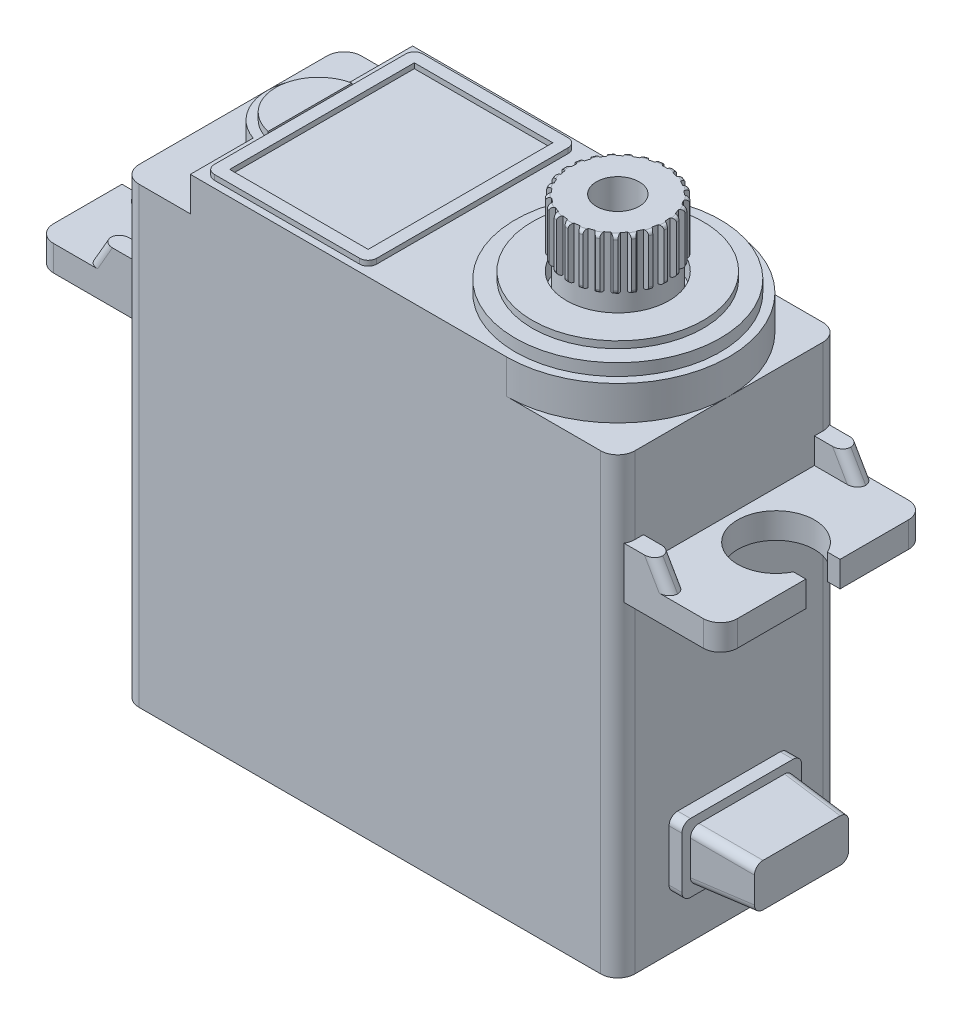
from build123d import *
from OCP.BRepFilletAPI import BRepFilletAPI_MakeChamfer

# Parameters (mm, degrees)
SKETCH1_W               = 29
SKETCH1_H               = 13.000000000000002
BOSS_EXTRUDE1_DEPTH     = 28.5
BOSS_EXTRUDE2_DEPTH     = 5.5
SKETCH4_W               = 1
SKETCH4_H               = 1.5000000000000036
BOSS_EXTRUDE3_DEPTH     = 2.5
CUT_EXTRUDE2_DEPTH      = 2
CUT_EXTRUDE1_DEPTH      = 2
SKETCH7_R               = 6
SKETCH7_R_2             = 2.999999999999999
BOSS_EXTRUDE4_DEPTH     = 0.7
SKETCH8_R               = 5.000000000000001
SKETCH8_R_2             = 2.999999999999999
BOSS_EXTRUDE5_DEPTH     = 0.4
BOSS_EXTRUDE6_DEPTH     = 0.3
BOSS_EXTRUDE7_DEPTH     = 0.4
SKETCH11_R              = 2.7499999999999982
SKETCH11_R_2            = 1.2499999999999991
BOSS_EXTRUDE8_DEPTH     = 5
BOSS_EXTRUDE9_START     = -3
BOSS_EXTRUDE9_DEPTH     = 3
CIRPATTERN1_COUNT       = 25
FILLET1_R               = 0.2
CUT_EXTRUDE3_DEPTH      = 10
SKETCH15_W              = 0.5000000000000009
SKETCH15_H              = 3
CUT_EXTRUDE4_DEPTH      = 5.5
SKETCH16_W              = 0.5
SKETCH16_H              = 1.5000000000000036
BOSS_EXTRUDE10_DEPTH    = 2.5
MIRROR4_COPY_1_SKETCH_W = 0.5000000000000009
MIRROR4_COPY_1_SKETCH_H = 3
MIRROR4_COPY_1_DEPTH    = 5.5
MIRROR4_COPY_2_SKETCH_W = 0.5
MIRROR4_COPY_2_SKETCH_H = 1.5000000000000036
MIRROR4_COPY_2_DEPTH    = 2.5
FILLET2_R               = 1
CHAMFER1_SIZE           = 0.866025404
CHAMFER1_SIZE_2         = 1.5
FILLET3_R               = 0.5
BOSS_EXTRUDE11_DEPTH    = 0.75
BOSS_EXTRUDE12_DEPTH    = 3.5
CHAMFER2_SIZE           = 3.5
CHAMFER2_SIZE_2         = 0.244743842
FILLET4_R               = 0.5


# Some blends are built 0.0001 mm under size
with BuildPart() as part:
    # Sketch1 → Boss-Extrude1 (new body)
    with BuildSketch(Plane(origin=(0, 0, 0), x_dir=(1, 0, 0), z_dir=(0, 1, 0))):
        Rectangle(SKETCH1_W, SKETCH1_H)
    extrude(amount=BOSS_EXTRUDE1_DEPTH)

    # Sketch3 → Boss-Extrude2 (add)
    with BuildSketch(Plane.ZY.offset(14.500000000000002)):
        Polygon((6.500000000000001, 20.5), (-6.499999999999999, 20.5), (-6.5, 18.999999999999996), (6.500000000000001, 19), align=None)
    boss_extrude2 = extrude(amount=BOSS_EXTRUDE2_DEPTH)

    # Sketch4 → Boss-Extrude3 (add)
    with BuildSketch(Plane.ZY.offset(14.500000000000002)):
        with Locations((-5.999999999999999, 21.25)):
            Rectangle(SKETCH4_W, SKETCH4_H)
        with Locations((6.000000000000001, 21.25)):
            Rectangle(SKETCH4_W, SKETCH4_H)
    boss_extrude3 = extrude(amount=BOSS_EXTRUDE3_DEPTH)

    # Sketch6 → Cut-Extrude2 (cut)
    with BuildSketch(Plane(origin=(0, 28.5, 0), x_dir=(1, 0, 0), z_dir=(0, 1, 0))):
        with BuildLine():
            Line((-14.500000000000002, 6.5), (-14.500000000000002, -6.5))
            Line((-14.500000000000002, -6.5), (-10.500000000000002, -6.5))
            Line((-10.500000000000002, -6.5), (-10.500000000000002, -2.828427124746192))
            ThreePointArc((-10.499999999999996, -2.82842712474619), (-12.500000000000002, 2.1e-15), (-10.499999999999996, 2.8284271247461943))
            Line((-10.500000000000002, 2.828427124746197), (-10.500000000000002, 6.5))
            Line((-10.500000000000002, 6.5), (-14.500000000000002, 6.5))
        make_face()
    extrude(amount=-CUT_EXTRUDE2_DEPTH, mode=Mode.SUBTRACT)

    # Mirror1: Boss-Extrude2, Boss-Extrude3 across plane
    add(boss_extrude2.mirror(Plane(origin=(0, 0, 0), x_dir=(0, 0, 1), z_dir=(1, 0, 0))))
    add(boss_extrude3.mirror(Plane(origin=(0, 0, 0), x_dir=(0, 0, 1), z_dir=(1, 0, 0))))

    # Sketch5 → Cut-Extrude1 (cut)
    with BuildSketch(Plane(origin=(0, 28.5, 0), x_dir=(1, 0, 0), z_dir=(0, 1, 0))):
        with BuildLine():
            Line((14.499999999999998, 6.5), (8.000000000000668, 6.5))
            ThreePointArc((8.000000000000668, 6.499999999999999), (12.596194077712795, 4.5961940777123225), (14.5, 0))
            Line((14.499999999999998, 0), (14.499999999999998, 6.5))
        make_face()
        with BuildLine():
            Line((14.499999999999998, -6.5), (14.499999999999998, 0))
            ThreePointArc((14.5, -1.59e-15), (12.596194077712791, -4.596194077712326), (8.000000000000663, -6.499999999999999))
            Line((8.000000000000663, -6.5), (14.499999999999998, -6.5))
        make_face()
    extrude(amount=-CUT_EXTRUDE1_DEPTH, mode=Mode.SUBTRACT)

    # Sketch7 → Boss-Extrude4 (add)
    with BuildSketch(Plane(origin=(0, 28.5, 0), x_dir=(1, 0, 0), z_dir=(0, 1, 0))):
        with Locations(Location((8, 0, 0), (0, 0, 270))):
            Circle(SKETCH7_R)
        with Locations(Location((8, 0, 0), (0, 0, 270))):
            Circle(SKETCH7_R_2, mode=Mode.SUBTRACT)
    extrude(amount=BOSS_EXTRUDE4_DEPTH)

    # Sketch8 → Boss-Extrude5 (add)
    with BuildSketch(Plane(origin=(0, 29.2, 0), x_dir=(1, 0, 0), z_dir=(0, 1, 0))):
        with Locations(Location((8, 0, 0), (0, 0, 270))):
            Circle(SKETCH8_R)
        with Locations(Location((8, 0, 0), (0, 0, 270))):
            Circle(SKETCH8_R_2, mode=Mode.SUBTRACT)
    extrude(amount=BOSS_EXTRUDE5_DEPTH)

    # Sketch9 → Boss-Extrude6 (add)
    with BuildSketch(Plane(origin=(0, 28.5, 0), x_dir=(1, 0, 0), z_dir=(0, 1, 0))):
        with BuildLine():
            Line((-1.0000000000000064, -6.1), (-9.499999999999998, -6.1))
            ThreePointArc((-9.499999999999998, -6.1), (-9.853553390593277, -5.953553390593273), (-10.000000000000002, -5.599999999999995))
            Line((-10.000000000000002, -5.599999999999995), (-10.000000000000002, 5.599999999999995))
            ThreePointArc((-10.000000000000002, 5.599999999999995), (-9.853553390593277, 5.953553390593273), (-9.499999999999998, 6.1))
            Line((-9.499999999999998, 6.1), (-1.0000000000000064, 6.1))
            ThreePointArc((-1.0000000000000064, 6.1), (-0.646446609406729, 5.953553390593273), (-0.5000000000000028, 5.599999999999995))
            Line((-0.5000000000000028, 5.599999999999995), (-0.5000000000000028, -5.599999999999995))
            ThreePointArc((-0.5000000000000028, -5.599999999999995), (-0.6464466094067285, -5.953553390593273), (-1.0000000000000064, -6.1))
        make_face()
        Polygon((-1.2000000000000026, 5.4), (-9.300000000000002, 5.400000000000001), (-9.300000000000002, -5.399999999999999), (-1.2000000000000026, -5.399999999999999), align=None, mode=Mode.SUBTRACT)
    extrude(amount=BOSS_EXTRUDE6_DEPTH)

    # Sketch10 → Boss-Extrude7 (add)
    with BuildSketch(Plane(origin=(0, 28.5, 0), x_dir=(1, 0, 0), z_dir=(0, 1, 0))):
        with BuildLine():
            Line((-10.000000000000002, -2.4494897427831703), (-10.000000000000002, 2.449489742783176))
            ThreePointArc((-10.000000000000014, 2.449489742783179), (-12.000000000000002, 3.34e-15), (-10.000000000000016, -2.4494897427831726))
        make_face()
    extrude(amount=BOSS_EXTRUDE7_DEPTH)

    # Sketch11 → Boss-Extrude8 (add)
    with BuildSketch(Plane(origin=(0, 28.5, 0), x_dir=(1, 0, 0), z_dir=(0, 1, 0))):
        with Locations(Location((8, 0, 0), (0, 0, 270))):
            Circle(SKETCH11_R)
        with Locations(Location((8, 0, 0), (0, 0, 270))):
            Circle(SKETCH11_R_2, mode=Mode.SUBTRACT)
    extrude(amount=BOSS_EXTRUDE8_DEPTH)

    # Sketch12 → Boss-Extrude9 (add)
    with BuildSketch(Plane(origin=(0, 33.5, 0), x_dir=(1, 0, 0), z_dir=(0, 1, 0)).offset(BOSS_EXTRUDE9_START)):
        with BuildLine():
            Line((8, -2.9993717459539933), (8, -2.7499999999999982))
            ThreePointArc((7.999999999999963, -2.7499999999999982), (7.903046472178413, -2.7482903801168717), (7.806213492486976, -2.7431636461403275))
            Line((7.80621349248696, -2.7431636461403417), (7.903580759911805, -2.9978215758394273))
            ThreePointArc((7.9035807599119, -2.9978215758393527), (7.951784149684609, -2.9989841783853195), (8.000000000000032, -2.9993717459539933))
        make_face()
        with BuildLine():
            ThreePointArc((8.193786507513028, -2.743163646140327), (8.096953527821553, -2.748290380116873), (7.999999999999963, -2.7499999999999982))
            Line((8, -2.7499999999999982), (8, -2.9993717459539933))
            ThreePointArc((8.000000000000032, -2.9993717459539933), (8.048215850315435, -2.998984178385319), (8.096419240088123, -2.997821575839352))
            Line((8.0964192400882, -2.997821575839412), (8.19378650751304, -2.743163646140337))
        make_face()
    boss_extrude9 = extrude(amount=BOSS_EXTRUDE9_DEPTH)

    # CirPattern1: Boss-Extrude9 ×25 about axis
    cirpattern1_axis = Axis((7.999999999999998, 0, -1.5e-16), (0, 1, 0))
    for i in range(1, CIRPATTERN1_COUNT):
        add(boss_extrude9.rotate(cirpattern1_axis, i * 360 / CIRPATTERN1_COUNT))

    # Fillet1
    fillet1_edges = [part.edges().sort_by_distance(p)[0] for p in [
        (8.000000000000007, 30.5, 2.9993717459539937),
        (8.000000000000007, 33.5, 2.9993717459539933),
        (8.74591342106676, 30.5, 2.905140967096018),
        (8.74591342106676, 33.5, 2.9051409670960178),
        (9.444958358610219, 30.5, 2.6283694969143063),
        (9.444958358610219, 33.5, 2.628369496914306),
        (10.053211248297089, 30.5, 2.1864479047746403),
        (10.053211248297089, 33.5, 2.18644790477464),
        (10.532453324070694, 30.5, 1.6071437495850773),
        (10.532453324070694, 33.5, 1.6071437495850773),
        (10.852572043781118, 30.5, 0.9268568419478322),
        (10.852572043781118, 33.5, 0.9268568419478322),
        (10.993453170954655, 30.5, 0.18833211018998597),
        (10.993453170954655, 33.5, 0.18833211018998597),
        (10.946244626246452, 30.5, -0.562026220688149),
        (10.946244626246452, 33.5, -0.562026220688149),
        (10.713912696141406, 30.5, -1.2770703771325946),
        (10.713912696141406, 33.5, -1.2770703771325946),
        (10.311055650265084, 30.5, -1.9118715050454949),
        (10.311055650265084, 33.5, -1.9118715050454949),
        (9.762986478414476, 30.5, -2.426542714924844),
        (9.762986478414476, 33.5, -2.4265427149248433),
        (9.104142382314365, 30.5, -2.7887453218256164),
        (9.104142382314365, 33.5, -2.7887453218256155),
        (8.375920959581816, 30.5, -2.9757208038682323),
        (8.375920959581816, 33.5, -2.9757208038682323),
        (7.624079040418163, 30.5, -2.9757208038682306),
        (7.624079040418163, 33.5, -2.9757208038682297),
        (6.895857617685614, 30.5, -2.78874532182561),
        (6.895857617685614, 33.5, -2.7887453218256097),
        (6.237013521585508, 30.5, -2.426542714924833),
        (6.237013521585508, 33.5, -2.4265427149248326),
        (5.688944349734901, 30.5, -1.9118715050454806),
        (5.688944349734902, 33.5, -1.9118715050454798),
        (5.286087303858583, 30.5, -1.2770703771325769),
        (5.286087303858584, 33.5, -1.2770703771325769),
        (5.053755373753541, 30.5, -0.5620262206881304),
        (5.053755373753542, 33.5, -0.5620262206881304),
        (5.006546829045341, 30.5, 0.1883321101900055),
        (5.006546829045342, 33.5, 0.1883321101900055),
        (5.147427956218882, 30.5, 0.9268568419478491),
        (5.147427956218883, 33.5, 0.9268568419478491),
        (5.46754667592931, 30.5, 1.6071437495850942),
        (5.467546675929311, 33.5, 1.6071437495850942),
        (5.946788751702921, 30.5, 2.186447904774652),
        (5.946788751702922, 33.5, 2.186447904774652),
        (6.555041641389793, 30.5, 2.628369496914315),
        (6.555041641389793, 33.5, 2.628369496914315),
        (7.254086578933256, 30.5, 2.905140967096023),
        (7.254086578933256, 33.5, 2.905140967096023),
    ]]
    fillet(fillet1_edges, radius=FILLET1_R)

    # Sketch14 → Cut-Extrude3 (cut)
    with BuildSketch(Plane(origin=(0, 20.5, 0), x_dir=(1, 0, 0), z_dir=(0, 1, 0))):
        with BuildLine():
            ThreePointArc((19.26959920937688, 0.9999999999999036), (15.004034772302198, 1.038e-14), (19.269599209376874, -0.9999999999999222))
            Line((19.269599209376903, -1.0000000000000102), (19.000000000000004, -1.0000000000000102))
            Line((19.000000000000004, -1.0000000000000102), (19.000000000000004, 0.9999999999999893))
            Line((19.000000000000004, 0.9999999999999893), (19.26959920937691, 0.9999999999999893))
        make_face()
        with BuildLine():
            ThreePointArc((19.269599209376874, -0.9999999999999222), (19.428282009287358, -0.5789205061684979), (19.5, -0.1346855447788077))
            Line((19.500000000000004, -0.13468554477880768), (19.500000000000004, 0.13468554477880867))
            ThreePointArc((19.5, 0.1346855447788085), (19.42828200928736, 0.5789205061684893), (19.26959920937688, 0.9999999999999036))
            Line((19.26959920937691, 0.9999999999999893), (19.000000000000004, 0.9999999999999893))
            Line((19.000000000000004, 0.9999999999999893), (19.000000000000004, -1.0000000000000102))
            Line((19.000000000000004, -1.0000000000000102), (19.269599209376903, -1.0000000000000102))
        make_face()
        with BuildLine():
            Line((19.500000000000004, -1.0000000000000102), (20.000000000000004, -1.0000000000000102))
            Line((20.000000000000004, -1.0000000000000102), (20.000000000000004, 0.9999999999999898))
            Line((20.000000000000004, 0.9999999999999898), (19.500000000000004, 0.9999999999999898))
            Line((19.500000000000004, 0.9999999999999898), (19.500000000000004, 0.13468554477880867))
            ThreePointArc((19.5, 0.1346855447788085), (19.50302585302262, 0.06737298301228589), (19.504034772302198, 1.1e-16))
            ThreePointArc((19.504034772302198, -4.4e-16), (19.50302585302262, -0.06737298301228464), (19.5, -0.1346855447788077))
            Line((19.500000000000004, -0.13468554477880768), (19.500000000000004, -1.0000000000000102))
        make_face()
        with BuildLine():
            Line((19.500000000000004, 0.13468554477880867), (19.500000000000004, 0.9999999999999898))
            Line((19.500000000000004, 0.9999999999999893), (19.26959920937691, 0.9999999999999893))
            ThreePointArc((19.26959920937688, 0.9999999999999036), (19.42828200928736, 0.5789205061684893), (19.5, 0.1346855447788085))
        make_face()
        with BuildLine():
            Line((19.269599209376903, -1.0000000000000102), (19.500000000000004, -1.0000000000000102))
            Line((19.500000000000004, -1.0000000000000102), (19.500000000000004, -0.13468554477880768))
            ThreePointArc((19.5, -0.1346855447788077), (19.428282009287358, -0.5789205061684979), (19.269599209376874, -0.9999999999999222))
        make_face()
        with BuildLine():
            Line((19.500000000000004, 0.13468554477880867), (19.500000000000004, -0.13468554477880768))
            ThreePointArc((19.5, -0.1346855447788077), (19.50302585302262, -0.06737298301228464), (19.504034772302198, -4.4e-16))
            ThreePointArc((19.504034772302198, 1.1e-16), (19.50302585302262, 0.06737298301228589), (19.5, 0.1346855447788085))
        make_face()
    cut_extrude3 = extrude(amount=-CUT_EXTRUDE3_DEPTH, mode=Mode.SUBTRACT)

    # Mirror2: Cut-Extrude3 across plane
    add(cut_extrude3.mirror(Plane(origin=(0, 0, 0), x_dir=(0, 0, 1), z_dir=(1, 0, 0))), mode=Mode.SUBTRACT)

    # Sketch15 → Cut-Extrude4 (cut)
    with BuildSketch(Plane.ZY.offset(20.000000000000004)):
        with Locations((6.25, 20.5)):
            Rectangle(SKETCH15_W, SKETCH15_H)
    cut_extrude4 = extrude(amount=-CUT_EXTRUDE4_DEPTH, mode=Mode.SUBTRACT)

    # Sketch16 → Boss-Extrude10 (add)
    with BuildSketch(Plane.ZY.offset(14.500000000000002)):
        with Locations((5.250000000000001, 21.25)):
            Rectangle(SKETCH16_W, SKETCH16_H)
    boss_extrude10 = extrude(amount=BOSS_EXTRUDE10_DEPTH)

    # Mirror3: Cut-Extrude4, Boss-Extrude10 across plane
    add(cut_extrude4.mirror(Plane.XY), mode=Mode.SUBTRACT)
    add(boss_extrude10.mirror(Plane.XY))

    # Mirror4: Cut-Extrude4, Boss-Extrude10 across plane
    add(cut_extrude4.mirror(Plane(origin=(0, 0, 0), x_dir=(0, 0, 1), z_dir=(1, 0, 0))), mode=Mode.SUBTRACT)
    add(boss_extrude10.mirror(Plane(origin=(0, 0, 0), x_dir=(0, 0, 1), z_dir=(1, 0, 0))))

    # Mirror4 copy 1 sketch → Mirror4 copy 1 (cut)
    with BuildSketch(Plane(origin=(20.000000000000004, 0, 0), x_dir=(0, 0, -1), z_dir=(1, 0, 0))):
        with Locations((6.25, 20.5)):
            Rectangle(MIRROR4_COPY_1_SKETCH_W, MIRROR4_COPY_1_SKETCH_H)
    extrude(amount=-MIRROR4_COPY_1_DEPTH, mode=Mode.SUBTRACT)

    # Mirror4 copy 2 sketch → Mirror4 copy 2 (add)
    with BuildSketch(Plane(origin=(14.500000000000002, 0, 0), x_dir=(0, 0, -1), z_dir=(1, 0, 0))):
        with Locations((5.250000000000001, 21.25)):
            Rectangle(MIRROR4_COPY_2_SKETCH_W, MIRROR4_COPY_2_SKETCH_H)
    extrude(amount=MIRROR4_COPY_2_DEPTH)

    # Fillet2
    # the kernel refuses this fillet: 1 mm, written as the material it takes off along each edge
    with BuildSketch(Plane(origin=(14.499999999999998, 29, -6.5), x_dir=(0, 0, 1), z_dir=(0, -1, 0))) as fillet2_piece_1_section:
        with BuildLine():
            CenterArc((FILLET2_R, FILLET2_R), FILLET2_R, 180, 90)
            Line((0, FILLET2_R), (0, 0))
            Line((0, 0), (FILLET2_R, 0))
        make_face()
    fillet2_piece_1 = extrude(amount=31.5, mode=Mode.PRIVATE)
    fillet2_piece_1 = split(fillet2_piece_1, bisect_by=Plane(origin=(14.47599161831564, 22.000000000000004, -5.836749215480762), z_dir=(0, 1, 0)), keep=Keep.TOP, mode=Mode.PRIVATE)
    fillet2_piece_1 = split(fillet2_piece_1, bisect_by=Plane(origin=(14.47599161831564, 25.499999999999993, -6), z_dir=(0, 0, 1)), keep=Keep.TOP, mode=Mode.PRIVATE)
    add(fillet2_piece_1, mode=Mode.SUBTRACT)
    with BuildSketch(Plane(origin=(14.499999999999998, 29, -6.5), x_dir=(0, 0, 1), z_dir=(0, -1, 0))) as fillet2_piece_2_section:
        with BuildLine():
            CenterArc((FILLET2_R, FILLET2_R), FILLET2_R, 180, 90)
            Line((0, FILLET2_R), (0, 0))
            Line((0, 0), (FILLET2_R, 0))
        make_face()
    fillet2_piece_2 = extrude(amount=31.5, mode=Mode.PRIVATE)
    fillet2_piece_2 = split(fillet2_piece_2, bisect_by=Plane(origin=(14.24487994003005, 22.000000000000004, -6.335608235695797), z_dir=(0, 1, 0)), keep=Keep.TOP, mode=Mode.PRIVATE)
    fillet2_piece_2 = split(fillet2_piece_2, bisect_by=Plane(origin=(14.24487994003005, 25.500000000000004, -6), z_dir=(0, 0, -1)), keep=Keep.TOP, mode=Mode.PRIVATE)
    add(fillet2_piece_2, mode=Mode.SUBTRACT)
    with BuildSketch(Plane(origin=(14.499999999999998, 29, -6.5), x_dir=(0, 0, 1), z_dir=(0, -1, 0))) as fillet2_piece_3_section:
        with BuildLine():
            CenterArc((FILLET2_R, FILLET2_R), FILLET2_R, 180, 90)
            Line((0, FILLET2_R), (0, 0))
            Line((0, 0), (FILLET2_R, 0))
        make_face()
    fillet2_piece_3 = extrude(amount=31.5, mode=Mode.PRIVATE)
    fillet2_piece_3 = split(fillet2_piece_3, bisect_by=Plane(origin=(14.244879940030046, 18.999999999999996, -6.335608235695797), z_dir=(0, 1, -2.7e-16)), keep=Keep.TOP, mode=Mode.PRIVATE)
    fillet2_piece_3 = split(fillet2_piece_3, bisect_by=Plane(origin=(14.244879940030046, 22.000000000000004, -6.335608235695797), z_dir=(0, -1, 0)), keep=Keep.TOP, mode=Mode.PRIVATE)
    fillet2_piece_3 = split(fillet2_piece_3, bisect_by=Plane(origin=(14.244879940030046, 20.5, -6), z_dir=(0, 0, -1)), keep=Keep.TOP, mode=Mode.PRIVATE)
    add(fillet2_piece_3, mode=Mode.SUBTRACT)
    with BuildSketch(Plane(origin=(14.499999999999998, 29, -6.5), x_dir=(0, 0, 1), z_dir=(0, -1, 0))) as fillet2_piece_4_section:
        with BuildLine():
            CenterArc((FILLET2_R, FILLET2_R), FILLET2_R, 180, 90)
            Line((0, FILLET2_R), (0, 0))
            Line((0, 0), (FILLET2_R, 0))
        make_face()
    fillet2_piece_4 = extrude(amount=31.5, mode=Mode.PRIVATE)
    fillet2_piece_4 = split(fillet2_piece_4, bisect_by=Plane(origin=(14.475991618315645, 18.999999999999996, -5.836749215480765), z_dir=(0, -1, 2.7e-16)), keep=Keep.TOP, mode=Mode.PRIVATE)
    fillet2_piece_4 = split(fillet2_piece_4, bisect_by=Plane(origin=(14.475991618315645, 8.25000000000001, -6), z_dir=(0, 0, 1)), keep=Keep.TOP, mode=Mode.PRIVATE)
    add(fillet2_piece_4, mode=Mode.SUBTRACT)
    with BuildSketch(Plane(origin=(14.499999999999998, 29, -6.5), x_dir=(0, 0, 1), z_dir=(0, -1, 0))) as fillet2_piece_5_section:
        with BuildLine():
            CenterArc((FILLET2_R, FILLET2_R), FILLET2_R, 180, 90)
            Line((0, FILLET2_R), (0, 0))
            Line((0, 0), (FILLET2_R, 0))
        make_face()
    fillet2_piece_5 = extrude(amount=31.5, mode=Mode.PRIVATE)
    fillet2_piece_5 = split(fillet2_piece_5, bisect_by=Plane(origin=(14.244879940030051, 18.999999999999996, -6.3356082356958), z_dir=(0, -1, 2.7e-16)), keep=Keep.TOP, mode=Mode.PRIVATE)
    fillet2_piece_5 = split(fillet2_piece_5, bisect_by=Plane(origin=(14.244879940030051, 8.250000000000002, -6), z_dir=(0, 0, -1)), keep=Keep.TOP, mode=Mode.PRIVATE)
    add(fillet2_piece_5, mode=Mode.SUBTRACT)
    with BuildSketch(Plane(origin=(14.499999999999998, -2.5, 6.5), x_dir=(0, 0, -1), z_dir=(0, 1, 0))) as fillet2_piece_6_section:
        with BuildLine():
            CenterArc((FILLET2_R, FILLET2_R), FILLET2_R, 180, 90)
            Line((0, FILLET2_R), (0, 0))
            Line((0, 0), (FILLET2_R, 0))
        make_face()
    fillet2_piece_6 = extrude(amount=31.5, mode=Mode.PRIVATE)
    fillet2_piece_6 = split(fillet2_piece_6, bisect_by=Plane(origin=(14.475991618315645, 19, 5.83674921548076), z_dir=(0, -1, 2.7e-16)), keep=Keep.TOP, mode=Mode.PRIVATE)
    fillet2_piece_6 = split(fillet2_piece_6, bisect_by=Plane(origin=(14.475991618315645, 8.250000000000007, 6), z_dir=(0, 0, -1)), keep=Keep.TOP, mode=Mode.PRIVATE)
    add(fillet2_piece_6, mode=Mode.SUBTRACT)
    with BuildSketch(Plane(origin=(14.499999999999998, -2.5, 6.5), x_dir=(0, 0, -1), z_dir=(0, 1, 0))) as fillet2_piece_7_section:
        with BuildLine():
            CenterArc((FILLET2_R, FILLET2_R), FILLET2_R, 180, 90)
            Line((0, FILLET2_R), (0, 0))
            Line((0, 0), (FILLET2_R, 0))
        make_face()
    fillet2_piece_7 = extrude(amount=31.5, mode=Mode.PRIVATE)
    fillet2_piece_7 = split(fillet2_piece_7, bisect_by=Plane(origin=(14.244879940030048, 19, 6.335608235695794), z_dir=(0, -1, 2.7e-16)), keep=Keep.TOP, mode=Mode.PRIVATE)
    fillet2_piece_7 = split(fillet2_piece_7, bisect_by=Plane(origin=(14.244879940030048, 8.250000000000002, 6), z_dir=(0, 0, 1)), keep=Keep.TOP, mode=Mode.PRIVATE)
    add(fillet2_piece_7, mode=Mode.SUBTRACT)
    with BuildSketch(Plane(origin=(14.499999999999998, -2.5, 6.5), x_dir=(0, 0, -1), z_dir=(0, 1, 0))) as fillet2_piece_8_section:
        with BuildLine():
            CenterArc((FILLET2_R, FILLET2_R), FILLET2_R, 180, 90)
            Line((0, FILLET2_R), (0, 0))
            Line((0, 0), (FILLET2_R, 0))
        make_face()
    fillet2_piece_8 = extrude(amount=31.5, mode=Mode.PRIVATE)
    fillet2_piece_8 = split(fillet2_piece_8, bisect_by=Plane(origin=(14.244879940030051, 19, 6.335608235695798), z_dir=(0, 1, -2.7e-16)), keep=Keep.TOP, mode=Mode.PRIVATE)
    fillet2_piece_8 = split(fillet2_piece_8, bisect_by=Plane(origin=(14.244879940030051, 20.500000000000004, 6), z_dir=(0, 0, 1)), keep=Keep.TOP, mode=Mode.PRIVATE)
    fillet2_piece_8 = split(fillet2_piece_8, bisect_by=Plane(origin=(14.244879940030051, 22.000000000000004, 6.335608235695797), z_dir=(0, -1, 0)), keep=Keep.TOP, mode=Mode.PRIVATE)
    add(fillet2_piece_8, mode=Mode.SUBTRACT)
    with BuildSketch(Plane(origin=(14.499999999999998, -2.5, 6.5), x_dir=(0, 0, -1), z_dir=(0, 1, 0))) as fillet2_piece_9_section:
        with BuildLine():
            CenterArc((FILLET2_R, FILLET2_R), FILLET2_R, 180, 90)
            Line((0, FILLET2_R), (0, 0))
            Line((0, 0), (FILLET2_R, 0))
        make_face()
    fillet2_piece_9 = extrude(amount=31.5, mode=Mode.PRIVATE)
    fillet2_piece_9 = split(fillet2_piece_9, bisect_by=Plane(origin=(14.475991618315637, 25.499999999999996, 6), z_dir=(0, 0, -1)), keep=Keep.TOP, mode=Mode.PRIVATE)
    fillet2_piece_9 = split(fillet2_piece_9, bisect_by=Plane(origin=(14.475991618315637, 22.000000000000004, 5.836749215480762), z_dir=(0, 1, 0)), keep=Keep.TOP, mode=Mode.PRIVATE)
    add(fillet2_piece_9, mode=Mode.SUBTRACT)
    with BuildSketch(Plane(origin=(14.499999999999998, -2.5, 6.5), x_dir=(0, 0, -1), z_dir=(0, 1, 0))) as fillet2_piece_10_section:
        with BuildLine():
            CenterArc((FILLET2_R, FILLET2_R), FILLET2_R, 180, 90)
            Line((0, FILLET2_R), (0, 0))
            Line((0, 0), (FILLET2_R, 0))
        make_face()
    fillet2_piece_10 = extrude(amount=31.5, mode=Mode.PRIVATE)
    fillet2_piece_10 = split(fillet2_piece_10, bisect_by=Plane(origin=(14.24487994003005, 25.5, 6), z_dir=(0, 0, 1)), keep=Keep.TOP, mode=Mode.PRIVATE)
    fillet2_piece_10 = split(fillet2_piece_10, bisect_by=Plane(origin=(14.24487994003005, 22.000000000000004, 6.335608235695797), z_dir=(0, 1, 0)), keep=Keep.TOP, mode=Mode.PRIVATE)
    add(fillet2_piece_10, mode=Mode.SUBTRACT)
    with BuildSketch(Plane(origin=(-14.500000000000002, -2.5, -6.5), x_dir=(0, 0, 1), z_dir=(0, 1, 0))) as fillet2_piece_11_section:
        with BuildLine():
            CenterArc((FILLET2_R, FILLET2_R), FILLET2_R, 180, 90)
            Line((0, FILLET2_R), (0, 0))
            Line((0, 0), (FILLET2_R, 0))
        make_face()
    fillet2_piece_11 = extrude(amount=31.5, mode=Mode.PRIVATE)
    fillet2_piece_11 = split(fillet2_piece_11, bisect_by=Plane(origin=(-14.475991618315646, 18.999999999999996, -5.836749215480765), z_dir=(0, -1, 2.7e-16)), keep=Keep.TOP, mode=Mode.PRIVATE)
    fillet2_piece_11 = split(fillet2_piece_11, bisect_by=Plane(origin=(-14.475991618315646, 8.249999999999998, -6), z_dir=(0, 0, 1)), keep=Keep.TOP, mode=Mode.PRIVATE)
    add(fillet2_piece_11, mode=Mode.SUBTRACT)
    with BuildSketch(Plane(origin=(-14.500000000000002, -2.5, -6.5), x_dir=(0, 0, 1), z_dir=(0, 1, 0))) as fillet2_piece_12_section:
        with BuildLine():
            CenterArc((FILLET2_R, FILLET2_R), FILLET2_R, 180, 90)
            Line((0, FILLET2_R), (0, 0))
            Line((0, 0), (FILLET2_R, 0))
        make_face()
    fillet2_piece_12 = extrude(amount=31.5, mode=Mode.PRIVATE)
    fillet2_piece_12 = split(fillet2_piece_12, bisect_by=Plane(origin=(-14.244879940030055, 18.999999999999996, -6.3356082356958), z_dir=(0, -1, 2.7e-16)), keep=Keep.TOP, mode=Mode.PRIVATE)
    fillet2_piece_12 = split(fillet2_piece_12, bisect_by=Plane(origin=(-14.244879940030055, 8.249999999999998, -6), z_dir=(0, 0, -1)), keep=Keep.TOP, mode=Mode.PRIVATE)
    add(fillet2_piece_12, mode=Mode.SUBTRACT)
    with BuildSketch(Plane(origin=(-14.500000000000002, -2.5, -6.5), x_dir=(0, 0, 1), z_dir=(0, 1, 0))) as fillet2_piece_13_section:
        with BuildLine():
            CenterArc((FILLET2_R, FILLET2_R), FILLET2_R, 180, 90)
            Line((0, FILLET2_R), (0, 0))
            Line((0, 0), (FILLET2_R, 0))
        make_face()
    fillet2_piece_13 = extrude(amount=31.5, mode=Mode.PRIVATE)
    fillet2_piece_13 = split(fillet2_piece_13, bisect_by=Plane(origin=(-14.244879940030053, 22.000000000000004, -6.335608235695798), z_dir=(0, -1, 0)), keep=Keep.TOP, mode=Mode.PRIVATE)
    fillet2_piece_13 = split(fillet2_piece_13, bisect_by=Plane(origin=(-14.244879940030053, 18.999999999999996, -6.335608235695798), z_dir=(0, 1, -2.7e-16)), keep=Keep.TOP, mode=Mode.PRIVATE)
    fillet2_piece_13 = split(fillet2_piece_13, bisect_by=Plane(origin=(-14.244879940030053, 20.5, -6), z_dir=(0, 0, -1)), keep=Keep.TOP, mode=Mode.PRIVATE)
    add(fillet2_piece_13, mode=Mode.SUBTRACT)
    with BuildSketch(Plane(origin=(-14.500000000000002, -2.5, -6.5), x_dir=(0, 0, 1), z_dir=(0, 1, 0))) as fillet2_piece_14_section:
        with BuildLine():
            CenterArc((FILLET2_R, FILLET2_R), FILLET2_R, 180, 90)
            Line((0, FILLET2_R), (0, 0))
            Line((0, 0), (FILLET2_R, 0))
        make_face()
    fillet2_piece_14 = extrude(amount=31.5, mode=Mode.PRIVATE)
    fillet2_piece_14 = split(fillet2_piece_14, bisect_by=Plane(origin=(-14.475991618315646, 22.000000000000004, -5.836749215480763), z_dir=(0, 1, 0)), keep=Keep.TOP, mode=Mode.PRIVATE)
    fillet2_piece_14 = split(fillet2_piece_14, bisect_by=Plane(origin=(-14.475991618315646, 25.500000000000004, -6), z_dir=(0, 0, 1)), keep=Keep.TOP, mode=Mode.PRIVATE)
    add(fillet2_piece_14, mode=Mode.SUBTRACT)
    with BuildSketch(Plane(origin=(-14.500000000000002, -2.5, -6.5), x_dir=(0, 0, 1), z_dir=(0, 1, 0))) as fillet2_piece_15_section:
        with BuildLine():
            CenterArc((FILLET2_R, FILLET2_R), FILLET2_R, 180, 90)
            Line((0, FILLET2_R), (0, 0))
            Line((0, 0), (FILLET2_R, 0))
        make_face()
    fillet2_piece_15 = extrude(amount=31.5, mode=Mode.PRIVATE)
    fillet2_piece_15 = split(fillet2_piece_15, bisect_by=Plane(origin=(-14.244879940030051, 22.000000000000004, -6.335608235695795), z_dir=(0, 1, 0)), keep=Keep.TOP, mode=Mode.PRIVATE)
    fillet2_piece_15 = split(fillet2_piece_15, bisect_by=Plane(origin=(-14.244879940030051, 25.499999999999996, -6), z_dir=(0, 0, -1)), keep=Keep.TOP, mode=Mode.PRIVATE)
    add(fillet2_piece_15, mode=Mode.SUBTRACT)
    with BuildSketch(Plane(origin=(-14.500000000000002, 29, 6.5), x_dir=(0, 0, -1), z_dir=(0, -1, 0))) as fillet2_piece_16_section:
        with BuildLine():
            CenterArc((FILLET2_R, FILLET2_R), FILLET2_R, 180, 90)
            Line((0, FILLET2_R), (0, 0))
            Line((0, 0), (FILLET2_R, 0))
        make_face()
    fillet2_piece_16 = extrude(amount=31.5, mode=Mode.PRIVATE)
    fillet2_piece_16 = split(fillet2_piece_16, bisect_by=Plane(origin=(-14.475991618315646, 22.000000000000004, 5.836749215480762), z_dir=(0, 1, 0)), keep=Keep.TOP, mode=Mode.PRIVATE)
    fillet2_piece_16 = split(fillet2_piece_16, bisect_by=Plane(origin=(-14.475991618315646, 25.500000000000004, 6), z_dir=(0, 0, -1)), keep=Keep.TOP, mode=Mode.PRIVATE)
    add(fillet2_piece_16, mode=Mode.SUBTRACT)
    with BuildSketch(Plane(origin=(-14.500000000000002, 29, 6.5), x_dir=(0, 0, -1), z_dir=(0, -1, 0))) as fillet2_piece_17_section:
        with BuildLine():
            CenterArc((FILLET2_R, FILLET2_R), FILLET2_R, 180, 90)
            Line((0, FILLET2_R), (0, 0))
            Line((0, 0), (FILLET2_R, 0))
        make_face()
    fillet2_piece_17 = extrude(amount=31.5, mode=Mode.PRIVATE)
    fillet2_piece_17 = split(fillet2_piece_17, bisect_by=Plane(origin=(-14.244879940030055, 22.000000000000004, 6.335608235695796), z_dir=(0, 1, 0)), keep=Keep.TOP, mode=Mode.PRIVATE)
    fillet2_piece_17 = split(fillet2_piece_17, bisect_by=Plane(origin=(-14.244879940030055, 25.5, 6), z_dir=(0, 0, 1)), keep=Keep.TOP, mode=Mode.PRIVATE)
    add(fillet2_piece_17, mode=Mode.SUBTRACT)
    with BuildSketch(Plane(origin=(-14.500000000000002, 29, 6.5), x_dir=(0, 0, -1), z_dir=(0, -1, 0))) as fillet2_piece_18_section:
        with BuildLine():
            CenterArc((FILLET2_R, FILLET2_R), FILLET2_R, 180, 90)
            Line((0, FILLET2_R), (0, 0))
            Line((0, 0), (FILLET2_R, 0))
        make_face()
    fillet2_piece_18 = extrude(amount=31.5, mode=Mode.PRIVATE)
    fillet2_piece_18 = split(fillet2_piece_18, bisect_by=Plane(origin=(-14.244879940030053, 22.000000000000004, 6.335608235695797), z_dir=(0, -1, 0)), keep=Keep.TOP, mode=Mode.PRIVATE)
    fillet2_piece_18 = split(fillet2_piece_18, bisect_by=Plane(origin=(-14.244879940030053, 20.500000000000004, 6), z_dir=(0, 0, 1)), keep=Keep.TOP, mode=Mode.PRIVATE)
    fillet2_piece_18 = split(fillet2_piece_18, bisect_by=Plane(origin=(-14.244879940030053, 19, 6.335608235695798), z_dir=(0, 1, -2.7e-16)), keep=Keep.TOP, mode=Mode.PRIVATE)
    add(fillet2_piece_18, mode=Mode.SUBTRACT)
    with BuildSketch(Plane(origin=(-14.500000000000002, 29, 6.5), x_dir=(0, 0, -1), z_dir=(0, -1, 0))) as fillet2_piece_19_section:
        with BuildLine():
            CenterArc((FILLET2_R, FILLET2_R), FILLET2_R, 180, 90)
            Line((0, FILLET2_R), (0, 0))
            Line((0, 0), (FILLET2_R, 0))
        make_face()
    fillet2_piece_19 = extrude(amount=31.5, mode=Mode.PRIVATE)
    fillet2_piece_19 = split(fillet2_piece_19, bisect_by=Plane(origin=(-14.475991618315645, 8.24999999999999, 6), z_dir=(0, 0, -1)), keep=Keep.TOP, mode=Mode.PRIVATE)
    fillet2_piece_19 = split(fillet2_piece_19, bisect_by=Plane(origin=(-14.475991618315645, 19, 5.836749215480758), z_dir=(0, -1, 2.7e-16)), keep=Keep.TOP, mode=Mode.PRIVATE)
    add(fillet2_piece_19, mode=Mode.SUBTRACT)
    with BuildSketch(Plane(origin=(-14.500000000000002, 29, 6.5), x_dir=(0, 0, -1), z_dir=(0, -1, 0))) as fillet2_piece_20_section:
        with BuildLine():
            CenterArc((FILLET2_R, FILLET2_R), FILLET2_R, 180, 90)
            Line((0, FILLET2_R), (0, 0))
            Line((0, 0), (FILLET2_R, 0))
        make_face()
    fillet2_piece_20 = extrude(amount=31.5, mode=Mode.PRIVATE)
    fillet2_piece_20 = split(fillet2_piece_20, bisect_by=Plane(origin=(-14.244879940030053, 8.249999999999998, 6), z_dir=(0, 0, 1)), keep=Keep.TOP, mode=Mode.PRIVATE)
    fillet2_piece_20 = split(fillet2_piece_20, bisect_by=Plane(origin=(-14.244879940030053, 19, 6.335608235695794), z_dir=(0, -1, 2.7e-16)), keep=Keep.TOP, mode=Mode.PRIVATE)
    add(fillet2_piece_20, mode=Mode.SUBTRACT)
    with BuildSketch(Plane(origin=(20, 16.5, -6), x_dir=(-1, 0, 0), z_dir=(0, 1, 0))) as fillet2_piece_21:
        with BuildLine():
            CenterArc((FILLET2_R, FILLET2_R), FILLET2_R, 180, 90)
            Line((0, FILLET2_R), (0, 0))
            Line((0, 0), (FILLET2_R, 0))
        make_face()
    extrude(amount=6.5, mode=Mode.SUBTRACT)
    with BuildSketch(Plane(origin=(20, 16.5, 6), x_dir=(0, 0, -1), z_dir=(0, 1, 0))) as fillet2_piece_22:
        with BuildLine():
            CenterArc((FILLET2_R, FILLET2_R), FILLET2_R, 180, 90)
            Line((0, FILLET2_R), (0, 0))
            Line((0, 0), (FILLET2_R, 0))
        make_face()
    extrude(amount=6.5, mode=Mode.SUBTRACT)
    with BuildSketch(Plane(origin=(-20, 16.5, 6), x_dir=(0, 0, -1), z_dir=(0, 1, 0))) as fillet2_piece_23:
        with BuildLine():
            CenterArc((FILLET2_R, -FILLET2_R), FILLET2_R, 90, 90)
            Line((0, -FILLET2_R), (0, 0))
            Line((0, 0), (FILLET2_R, 0))
        make_face()
    extrude(amount=6.5, mode=Mode.SUBTRACT)
    with BuildSketch(Plane(origin=(-20, 16.5, -6), x_dir=(1, 0, 0), z_dir=(0, 1, 0))) as fillet2_piece_24:
        with BuildLine():
            CenterArc((FILLET2_R, -FILLET2_R), FILLET2_R, 90, 90)
            Line((0, -FILLET2_R), (0, 0))
            Line((0, 0), (FILLET2_R, 0))
        make_face()
    extrude(amount=6.5, mode=Mode.SUBTRACT)

    # Chamfer1
    chamfer1_edges_1 = [part.edges().sort_by_distance(p)[0] for p in [
        (17, 22, 5.5),
    ]]
    chamfer1_side_1 = [part.faces().sort_by_distance(p)[0] for p in [
        (16.982679491924312, 22, 5.5),
    ]]
    chamfer1_edges_2 = [part.edges().sort_by_distance(p)[0] for p in [
        (17, 22, -5.5),
    ]]
    chamfer1_side_2 = [part.faces().sort_by_distance(p)[0] for p in [
        (16.982679491924312, 22, -5.5),
    ]]
    chamfer1_edges_3 = [part.edges().sort_by_distance(p)[0] for p in [
        (-17, 22, 5.5),
    ]]
    chamfer1_side_3 = [part.faces().sort_by_distance(p)[0] for p in [
        (-16.982679491924312, 22, 5.5),
    ]]
    chamfer1_edges_4 = [part.edges().sort_by_distance(p)[0] for p in [
        (-17, 22, -5.5),
    ]]
    chamfer1_side_4 = [part.faces().sort_by_distance(p)[0] for p in [
        (-16.982679491924312, 22, -5.5),
    ]]
    chamfer1 = BRepFilletAPI_MakeChamfer(part.part.solid().wrapped)
    for e in chamfer1_edges_1:
        chamfer1.Add(CHAMFER1_SIZE - 0.0001, CHAMFER1_SIZE_2 - 0.0001, e.wrapped, chamfer1_side_1[0].wrapped)
    for e in chamfer1_edges_2:
        chamfer1.Add(CHAMFER1_SIZE - 0.0001, CHAMFER1_SIZE_2 - 0.0001, e.wrapped, chamfer1_side_2[0].wrapped)
    for e in chamfer1_edges_3:
        chamfer1.Add(CHAMFER1_SIZE - 0.0001, CHAMFER1_SIZE_2 - 0.0001, e.wrapped, chamfer1_side_3[0].wrapped)
    for e in chamfer1_edges_4:
        chamfer1.Add(CHAMFER1_SIZE - 0.0001, CHAMFER1_SIZE_2 - 0.0001, e.wrapped, chamfer1_side_4[0].wrapped)
    add(Compound.cast(chamfer1.Shape()), mode=Mode.REPLACE)  # a hair under: the kernel refuses the full size

    # Fillet3
    # the kernel refuses this fillet: 0.5 mm, written as the material it takes off along each edge
    with BuildSketch(Plane(origin=(-15.509097474414984, 23.082544963267264, -5.000000000000001), x_dir=(0.8660359706138067, -0.49998169726801206, 0), z_dir=(-0.49998169726801206, -0.8660359706138065, 0))) as fillet3_piece_1_section:
        with BuildLine():
            CenterArc((FILLET3_R, -FILLET3_R), FILLET3_R, 90, 90)
            Line((-2.4e-16, -FILLET3_R), (0, 0))
            Line((0, 0), (FILLET3_R, 0))
        make_face()
    fillet3_piece_1 = extrude(amount=4.231914205523053, mode=Mode.PRIVATE)
    fillet3_piece_1 = split(fillet3_piece_1, bisect_by=Plane(origin=(-16.438106189283303, 20.5, -5.111683967354355), z_dir=(0, 1, 0)), keep=Keep.TOP, mode=Mode.PRIVATE)
    add(fillet3_piece_1, mode=Mode.SUBTRACT)
    with BuildSketch(Plane(origin=(-15.50909747441499, 23.082544963267257, 5.000000000000001), x_dir=(0.8660359706138067, -0.49998169726801206, 0), z_dir=(-0.49998169726801206, -0.8660359706138065, 0))) as fillet3_piece_2_section:
        with BuildLine():
            CenterArc((FILLET3_R, FILLET3_R), FILLET3_R, 180, 90)
            Line((-2.4e-16, FILLET3_R), (0, 0))
            Line((0, 0), (FILLET3_R, 0))
        make_face()
    fillet3_piece_2 = extrude(amount=4.231914205523053, mode=Mode.PRIVATE)
    fillet3_piece_2 = split(fillet3_piece_2, bisect_by=Plane(origin=(-16.438106189283303, 20.5, 5.111683967354353), z_dir=(0, 1, 0)), keep=Keep.TOP, mode=Mode.PRIVATE)
    add(fillet3_piece_2, mode=Mode.SUBTRACT)
    with BuildSketch(Plane(origin=(-15.509097474414988, 23.082544963267257, 6), x_dir=(0.8660359706138067, -0.49998169726801206, 0), z_dir=(-0.49998169726801206, -0.8660359706138065, 0))) as fillet3_piece_3_section:
        with BuildLine():
            CenterArc((FILLET3_R, -FILLET3_R), FILLET3_R, 90, 90)
            Line((-2.4e-16, -FILLET3_R), (0, 0))
            Line((0, 0), (FILLET3_R, 0))
        make_face()
    fillet3_piece_3 = extrude(amount=4.231914205523058, mode=Mode.PRIVATE)
    fillet3_piece_3 = split(fillet3_piece_3, bisect_by=Plane(origin=(-16.438106189283307, 20.5, 5.888316032645647), z_dir=(0, 1, 0)), keep=Keep.TOP, mode=Mode.PRIVATE)
    add(fillet3_piece_3, mode=Mode.SUBTRACT)
    with BuildSketch(Plane(origin=(15.50909747441499, 23.082544963267257, -6), x_dir=(-0.8660359706138067, -0.49998169726801206, 0), z_dir=(0.499981697268012, -0.8660359706138065, 0))) as fillet3_piece_4_section:
        with BuildLine():
            CenterArc((FILLET3_R, -FILLET3_R), FILLET3_R, 90, 90)
            Line((0, -FILLET3_R), (0, 0))
            Line((0, 0), (FILLET3_R, 0))
        make_face()
    fillet3_piece_4 = extrude(amount=4.231914205523061, mode=Mode.PRIVATE)
    fillet3_piece_4 = split(fillet3_piece_4, bisect_by=Plane(origin=(16.43810618928331, 20.5, -5.888316032645647), z_dir=(0, 1, 0)), keep=Keep.TOP, mode=Mode.PRIVATE)
    add(fillet3_piece_4, mode=Mode.SUBTRACT)
    with BuildSketch(Plane(origin=(15.509097474414988, 23.08254496326726, -5.000000000000001), x_dir=(-0.8660359706138067, -0.49998169726801206, 0), z_dir=(0.499981697268012, -0.8660359706138065, 0))) as fillet3_piece_5_section:
        with BuildLine():
            CenterArc((FILLET3_R, FILLET3_R), FILLET3_R, 180, 90)
            Line((0, FILLET3_R), (0, 0))
            Line((0, 0), (FILLET3_R, 0))
        make_face()
    fillet3_piece_5 = extrude(amount=4.2319142055230605, mode=Mode.PRIVATE)
    fillet3_piece_5 = split(fillet3_piece_5, bisect_by=Plane(origin=(16.438106189283307, 20.5, -5.111683967354355), z_dir=(0, 1, 0)), keep=Keep.TOP, mode=Mode.PRIVATE)
    add(fillet3_piece_5, mode=Mode.SUBTRACT)
    with BuildSketch(Plane(origin=(15.509097474414988, 23.08254496326726, 6), x_dir=(4.1e-16, 2.4e-16, -1), z_dir=(0.49998169726801206, -0.8660359706138065, 0))) as fillet3_piece_6_section:
        with BuildLine():
            CenterArc((FILLET3_R, -FILLET3_R), FILLET3_R, 89.99999999999997, 90.00000000000003)
            Line((-2.4e-16, -FILLET3_R), (0, 0))
            Line((0, 0), (FILLET3_R, 0))
        make_face()
    fillet3_piece_6 = extrude(amount=4.2319142055230525, mode=Mode.PRIVATE)
    fillet3_piece_6 = split(fillet3_piece_6, bisect_by=Plane(origin=(16.438106189370988, 20.5, 5.8883160326291035), z_dir=(0, 1, 0)), keep=Keep.TOP, mode=Mode.PRIVATE)
    add(fillet3_piece_6, mode=Mode.SUBTRACT)
    with BuildSketch(Plane(origin=(15.509097474414986, 23.082544963267264, 5.000000000000001), x_dir=(-0.8660359706138067, -0.49998169726801206, 0), z_dir=(0.49998169726801206, -0.8660359706138065, 0))) as fillet3_piece_7_section:
        with BuildLine():
            CenterArc((FILLET3_R, -FILLET3_R), FILLET3_R, 90, 90)
            Line((-2.4e-16, -FILLET3_R), (0, 0))
            Line((0, 0), (FILLET3_R, 0))
        make_face()
    fillet3_piece_7 = extrude(amount=4.231914205523053, mode=Mode.PRIVATE)
    fillet3_piece_7 = split(fillet3_piece_7, bisect_by=Plane(origin=(16.438106189283303, 20.5, 5.111683967354355), z_dir=(0, 1, 0)), keep=Keep.TOP, mode=Mode.PRIVATE)
    add(fillet3_piece_7, mode=Mode.SUBTRACT)
    with BuildSketch(Plane(origin=(-15.509097474414986, 23.08254496326726, -6), x_dir=(0.8660359706138067, -0.49998169726801206, 0), z_dir=(-0.49998169726801206, -0.8660359706138065, 0))) as fillet3_piece_8_section:
        with BuildLine():
            CenterArc((FILLET3_R, FILLET3_R), FILLET3_R, 180, 90)
            Line((-2.4e-16, FILLET3_R), (0, 0))
            Line((0, 0), (FILLET3_R, 0))
        make_face()
    fillet3_piece_8 = extrude(amount=4.2319142055230525, mode=Mode.PRIVATE)
    fillet3_piece_8 = split(fillet3_piece_8, bisect_by=Plane(origin=(-16.438106189283303, 20.5, -5.888316032645647), z_dir=(0, 1, 0)), keep=Keep.TOP, mode=Mode.PRIVATE)
    add(fillet3_piece_8, mode=Mode.SUBTRACT)

    # Sketch17 → Boss-Extrude11 (add)
    with BuildSketch(Plane(origin=(14.499999999999998, 0, 0), x_dir=(0, 0, -1), z_dir=(1, 0, 0))):
        with BuildLine():
            Line((-2.9999999999999933, 7.000000000000001), (3, 7.000000000000001))
            ThreePointArc((3, 7.000000000000001), (3.3535533905932775, 6.853553390593275), (3.5000000000000036, 6.499999999999997))
            Line((3.5000000000000036, 6.499999999999997), (3.500000000000004, 3.5000000000000044))
            ThreePointArc((3.500000000000004, 3.5000000000000044), (3.353553390593278, 3.146446609406727), (3.0000000000000004, 3.000000000000001))
            Line((3.0000000000000004, 3.000000000000001), (-2.999999999999993, 3.000000000000001))
            ThreePointArc((-2.999999999999993, 3.000000000000001), (-3.35355339059327, 3.1464466094067274), (-3.499999999999996, 3.5000000000000044))
            Line((-3.499999999999996, 3.5000000000000044), (-3.4999999999999964, 6.499999999999997))
            ThreePointArc((-3.4999999999999964, 6.499999999999997), (-3.3535533905932704, 6.853553390593275), (-2.9999999999999933, 7.000000000000001))
        make_face()
    extrude(amount=BOSS_EXTRUDE11_DEPTH)

    # Sketch18 → Boss-Extrude12 (add)
    with BuildSketch(Plane(origin=(15.25, 0, 0), x_dir=(0, 0, -1), z_dir=(1, 0, 0))):
        Polygon((-2.9999999999999956, 6.500000000000001), (3.0000000000000036, 6.500000000000001), (3.0000000000000044, 3.5000000000000004), (-2.9999999999999956, 3.5000000000000004), align=None)
    extrude(amount=BOSS_EXTRUDE12_DEPTH)

    # Chamfer2
    chamfer2_edges_1 = [part.edges().sort_by_distance(p)[0] for p in [
        (18.75, 5.000000000000001, 2.9999999999999956),
    ]]
    chamfer2_side_1 = [part.faces().sort_by_distance(p)[0] for p in [
        (18.745105123163952, 5.000000000000001, 2.9999999999999956),
    ]]
    chamfer2_edges_2 = [part.edges().sort_by_distance(p)[0] for p in [
        (18.75, 3.5000000000000004, -4.44e-15),
    ]]
    chamfer2_side_2 = [part.faces().sort_by_distance(p)[0] for p in [
        (18.745105123163952, 3.5000000000000004, -4.44e-15),
    ]]
    chamfer2_edges_3 = [part.edges().sort_by_distance(p)[0] for p in [
        (18.75, 5.000000000000001, -3.000000000000004),
    ]]
    chamfer2_side_3 = [part.faces().sort_by_distance(p)[0] for p in [
        (18.745105123163952, 5.000000000000001, -3.000000000000004),
    ]]
    chamfer2_edges_4 = [part.edges().sort_by_distance(p)[0] for p in [
        (18.75, 6.500000000000001, -4e-15),
    ]]
    chamfer2_side_4 = [part.faces().sort_by_distance(p)[0] for p in [
        (18.745105123163952, 6.500000000000001, -4e-15),
    ]]
    chamfer2 = BRepFilletAPI_MakeChamfer(part.part.solid().wrapped)
    for e in chamfer2_edges_1:
        chamfer2.Add(CHAMFER2_SIZE - 0.0001, CHAMFER2_SIZE_2 - 0.0001, e.wrapped, chamfer2_side_1[0].wrapped)
    for e in chamfer2_edges_2:
        chamfer2.Add(CHAMFER2_SIZE - 0.0001, CHAMFER2_SIZE_2 - 0.0001, e.wrapped, chamfer2_side_2[0].wrapped)
    for e in chamfer2_edges_3:
        chamfer2.Add(CHAMFER2_SIZE - 0.0001, CHAMFER2_SIZE_2 - 0.0001, e.wrapped, chamfer2_side_3[0].wrapped)
    for e in chamfer2_edges_4:
        chamfer2.Add(CHAMFER2_SIZE - 0.0001, CHAMFER2_SIZE_2 - 0.0001, e.wrapped, chamfer2_side_4[0].wrapped)
    add(Compound.cast(chamfer2.Shape()), mode=Mode.REPLACE)  # a hair under: the kernel refuses the full size

    # Fillet4
    # the kernel refuses this fillet: 0.5 mm, written as the material it takes off along each edge
    with BuildSketch(Plane(origin=(14.01219689616832, 6.586529721233496, -3.0865297212334974), x_dir=(-0.06939186580778699, 0.004850507915873692, 0.997577686966119), z_dir=(0.9951494777496215, -0.06956118506270499, 0.06956118506270484))) as fillet4_piece_1_section:
        with BuildLine():
            CenterArc((FILLET4_R * 0.99514947775, FILLET4_R), FILLET4_R, 180.27858955826824, 89.72141044173179)
            Line((-FILLET4_R * 0.00483870126845, FILLET4_R * 0.995137714106), (0, 0))
            Line((0, 0), (FILLET4_R * 0.99514947775, 0))
        make_face()
    fillet4_piece_1 = extrude(amount=6.004832782685581, mode=Mode.PRIVATE)
    fillet4_piece_1 = split(fillet4_piece_1, bisect_by=Plane(origin=(15.249999999999998, 6.26634892593093, -2.7663489259309313), z_dir=(1, 0, 0)), keep=Keep.TOP, mode=Mode.PRIVATE)
    add(fillet4_piece_1, mode=Mode.SUBTRACT)
    with BuildSketch(Plane(origin=(14.01219689616832, 3.4134702787665057, -3.086529721233499), x_dir=(-0.06939186580778704, 0.997577686966119, -0.004850507915873303), z_dir=(0.9951494777496215, 0.06956118506270487, 0.0695611850627049))) as fillet4_piece_2_section:
        with BuildLine():
            CenterArc((FILLET4_R * 0.99514947775, FILLET4_R), FILLET4_R, 180.2785895582683, 89.72141044173168)
            Line((-FILLET4_R * 0.00483870126845, FILLET4_R * 0.995137714106), (0, 0))
            Line((0, 0), (FILLET4_R * 0.99514947775, 0))
        make_face()
    fillet4_piece_2 = extrude(amount=6.004832782685585, mode=Mode.PRIVATE)
    fillet4_piece_2 = split(fillet4_piece_2, bisect_by=Plane(origin=(15.249999999999998, 3.7336510740690727, -2.7663489259309317), z_dir=(1, 0, 0)), keep=Keep.TOP, mode=Mode.PRIVATE)
    add(fillet4_piece_2, mode=Mode.SUBTRACT)
    with BuildSketch(Plane(origin=(14.012196896168318, 6.586529721233496, 3.08652972123349), x_dir=(-0.06939186580778699, 0.004850507915873943, -0.997577686966119), z_dir=(0.9951494777496215, -0.06956118506270499, -0.06956118506270487))) as fillet4_piece_3_section:
        with BuildLine():
            CenterArc((FILLET4_R * 0.99514947775, -FILLET4_R), FILLET4_R, 89.99999999999997, 89.72141044173182)
            Line((-FILLET4_R * 0.00483870126845, -FILLET4_R * 0.995137714106), (0, 0))
            Line((0, 0), (FILLET4_R * 0.99514947775, 0))
        make_face()
    fillet4_piece_3 = extrude(amount=6.004832782685582, mode=Mode.PRIVATE)
    fillet4_piece_3 = split(fillet4_piece_3, bisect_by=Plane(origin=(15.249999999999998, 6.266348925930928, 2.766348925930923), z_dir=(1, 0, 0)), keep=Keep.TOP, mode=Mode.PRIVATE)
    add(fillet4_piece_3, mode=Mode.SUBTRACT)
    with BuildSketch(Plane(origin=(14.012196896168316, 3.4134702787665057, 3.08652972123349), x_dir=(-0.06939186580778704, 0.997577686966119, 0.004850507915873303), z_dir=(0.9951494777496215, 0.06956118506270487, -0.06956118506270487))) as fillet4_piece_4_section:
        with BuildLine():
            CenterArc((FILLET4_R * 0.99514947775, -FILLET4_R), FILLET4_R, 90.00000000000001, 89.72141044173169)
            Line((-FILLET4_R * 0.00483870126845, -FILLET4_R * 0.995137714106), (0, 0))
            Line((0, 0), (FILLET4_R * 0.99514947775, 0))
        make_face()
    fillet4_piece_4 = extrude(amount=6.004832782685587, mode=Mode.PRIVATE)
    fillet4_piece_4 = split(fillet4_piece_4, bisect_by=Plane(origin=(15.249999999999998, 3.733651074069074, 2.7663489259309233), z_dir=(1, 0, 0)), keep=Keep.TOP, mode=Mode.PRIVATE)
    add(fillet4_piece_4, mode=Mode.SUBTRACT)


solid = part.part
